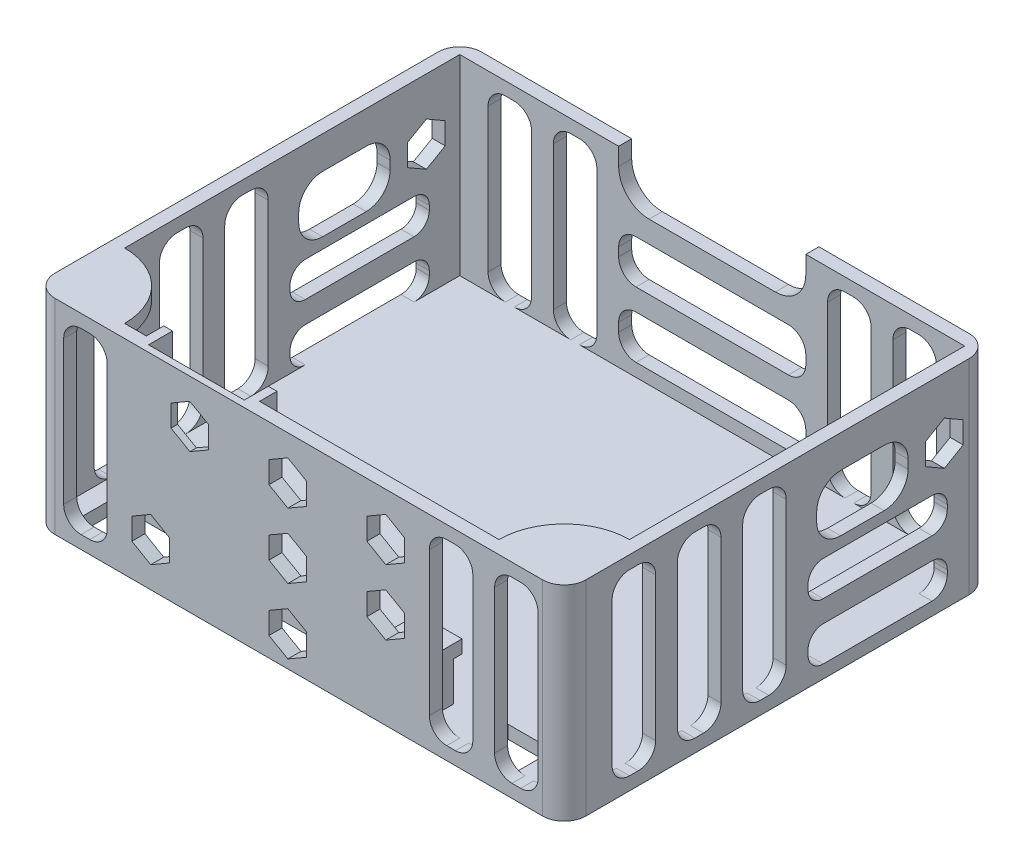
from build123d import *

# Parameters (mm, degrees)
SKETCH1_W                = 61
SKETCH1_H                = 49
BOSS_EXTRUDE1_DEPTH      = 23.5
SKETCH2_W                = 58
SKETCH2_H                = 46
CUT_EXTRUDE1_DEPTH       = 22
SKETCH3_W                = 16
SKETCH3_H                = 3
SKETCH3_W_2              = 5.2
SKETCH3_H_2              = 4.15
SKETCH3_W_3              = 12
SKETCH3_H_3              = 5
CUT_EXTRUDE2_DEPTH       = 1.5
SKETCH4_W                = 21.5
SKETCH4_H                = 1.5
CUT_EXTRUDE3_DEPTH       = 5.5
SKETCH5_W                = 10.5
SKETCH5_H                = 6.5
CUT_EXTRUDE6_DEPTH       = 61
SKETCH8_W                = 5
SKETCH8_H                = 3
BOSS_EXTRUDE2_DEPTH      = 6
SKETCH9_W                = 5
SKETCH9_H                = 1.5
BOSS_EXTRUDE3_DEPTH      = 1
SKETCH10_W               = 11
SKETCH10_H               = 11
CUT_EXTRUDE8_DEPTH       = 0.75
BOSS_EXTRUDE4_DEPTH      = 2
SKETCH12_W               = 7.5
SKETCH12_H               = 7.5
BOSS_EXTRUDE5_DEPTH      = 1.5
FILLET1_R                = 2.75
FILLET2_R                = 2.75
FILLET3_R                = 2.75
FILLET4_R                = 2.75
FILLET5_R                = 3.5
FILLET6_R                = 3.5
FILLET7_R                = 7.5
FILLET8_R                = 7.5
FILLET9_R                = 2.5
FILLET10_R               = 2.5
FILLET11_R               = 2.5
FILLET12_R               = 2.5
CUT_EXTRUDE10_DEPTH      = 61
FILLET13_R               = 2.75
FILLET14_R               = 2.75
FILLET15_R               = 2.75
FILLET16_R               = 2.75
CUT_EXTRUDE11_DEPTH      = 61
CUT_EXTRUDE12_DEPTH      = 1.5
CUT_EXTRUDE14_DEPTH      = 61
CUT_EXTRUDE15_DEPTH      = 1.5
CUT_EXTRUDE18_DEPTH      = 1.5
CUT_EXTRUDE18_DEPTH_BACK = 1.5
CUT_EXTRUDE19_DEPTH      = 1.5


with BuildPart() as part:
    # Sketch1 → Boss-Extrude1 (new body)
    with BuildSketch(Plane(origin=(0, 0, 0), x_dir=(1, 0, 0), z_dir=(0, 1, 0))):
        with Locations((-50.798701292, -19.282823978)):
            Rectangle(SKETCH1_W, SKETCH1_H)
    extrude(amount=BOSS_EXTRUDE1_DEPTH)

    # Sketch2 → Cut-Extrude1 (cut)
    with BuildSketch(Plane(origin=(0, 23.5, 0), x_dir=(1, 0, 0), z_dir=(0, 1, 0))):
        with Locations((-50.798701292, -19.282823978)):
            Rectangle(SKETCH2_W, SKETCH2_H)
    extrude(amount=-CUT_EXTRUDE1_DEPTH, mode=Mode.SUBTRACT)

    # Sketch3 → Cut-Extrude2 (cut)
    with BuildSketch(Plane(origin=(0, 1.5, 0), x_dir=(1, 0, 0), z_dir=(0, 1, 0))):
        with Locations((-50.538701292, -40.782823978)):
            Rectangle(SKETCH3_W, SKETCH3_H)
        with Locations((-29.798701292, -40.207823978)):
            Rectangle(SKETCH3_W_2, SKETCH3_H_2)
        with Locations((-71.538701292, -39.782823978)):
            Rectangle(SKETCH3_W_3, SKETCH3_H_3)
    extrude(amount=-CUT_EXTRUDE2_DEPTH, mode=Mode.SUBTRACT)

    # Sketch4 → Cut-Extrude3 (cut)
    with BuildSketch(Plane(origin=(0, 23.5, 0), x_dir=(1, 0, 0), z_dir=(0, 1, 0))):
        with Locations((-50.798701292, 4.467176022)):
            Rectangle(SKETCH4_W, SKETCH4_H)
    extrude(amount=-CUT_EXTRUDE3_DEPTH, mode=Mode.SUBTRACT)

    # Sketch5 → Cut-Extrude6 (cut)
    with BuildSketch(Plane.ZY.offset(81.298701292)):
        with Locations((9.532823978, 16.5)):
            Rectangle(SKETCH5_W, SKETCH5_H)
    extrude(amount=-CUT_EXTRUDE6_DEPTH, mode=Mode.SUBTRACT)

    # Sketch8 → Boss-Extrude2 (add)
    with BuildSketch(Plane(origin=(0, 1.5, 0), x_dir=(1, 0, 0), z_dir=(0, 1, 0))):
        with Locations((-40.038701292, -40.782823978)):
            Rectangle(SKETCH8_W, SKETCH8_H)
        with Locations((-61.038701292, -40.782823978)):
            Rectangle(SKETCH8_W, SKETCH8_H)
    extrude(amount=BOSS_EXTRUDE2_DEPTH)

    # Sketch9 → Boss-Extrude3 (add)
    with BuildSketch(Plane(origin=(0, 0, 39.282823978), x_dir=(-1, 0, 0), z_dir=(0, 0, -1))):
        with Locations((40.038701292, 6.75)):
            Rectangle(SKETCH9_W, SKETCH9_H)
        with Locations((61.038701292, 6.75)):
            Rectangle(SKETCH9_W, SKETCH9_H)
    extrude(amount=BOSS_EXTRUDE3_DEPTH)

    # Sketch10 → Cut-Extrude8 (cut)
    with BuildSketch(Plane(origin=(0, 0, 42.282823978), x_dir=(-1, 0, 0), z_dir=(0, 0, -1))):
        with Locations((63.298701292, 18)):
            Rectangle(SKETCH10_W, SKETCH10_H)
    extrude(amount=-CUT_EXTRUDE8_DEPTH, mode=Mode.SUBTRACT)

    # Sketch11 → Boss-Extrude4 (add)
    with BuildSketch(Plane(origin=(0, 0, 42.282823978), x_dir=(-1, 0, 0), z_dir=(0, 0, -1))):
        Polygon((57.798701292, 12.5), (57.798701292, 23.5), (56.798701292, 23.5), (56.798701292, 11.5), (69.798701292, 11.5), (69.798701292, 23.5), (68.798701292, 23.5), (68.798701292, 12.5), align=None)
    extrude(amount=BOSS_EXTRUDE4_DEPTH)

    # Sketch12 → Boss-Extrude5 (add)
    with BuildSketch(Plane(origin=(0, 23.5, 0), x_dir=(1, 0, 0), z_dir=(0, 1, 0))):
        with Locations((-25.548701292, -38.532823978)):
            Rectangle(SKETCH12_W, SKETCH12_H)
        with Locations((-76.048701292, -38.532823978)):
            Rectangle(SKETCH12_W, SKETCH12_H)
    extrude(amount=-BOSS_EXTRUDE5_DEPTH)

    # Fillet1
    fillet1_edges = [part.edges().sort_by_distance(p)[0] for p in [
        (-80.548701292, 13.25, 14.782823978),
    ]]
    fillet(fillet1_edges, radius=FILLET1_R)

    # Fillet2
    fillet2_edges = [part.edges().sort_by_distance(p)[0] for p in [
        (-80.548701292, 19.75, 14.782823978),
    ]]
    fillet(fillet2_edges, radius=FILLET2_R)

    # Fillet3
    fillet3_edges = [part.edges().sort_by_distance(p)[0] for p in [
        (-80.548701292, 19.75, 4.282823978),
    ]]
    fillet(fillet3_edges, radius=FILLET3_R)

    # Fillet4
    fillet4_edges = [part.edges().sort_by_distance(p)[0] for p in [
        (-80.548701292, 13.25, 4.282823978),
    ]]
    fillet(fillet4_edges, radius=FILLET4_R)

    # Fillet5
    fillet5_edges = [part.edges().sort_by_distance(p)[0] for p in [
        (-40.048701292, 18, -4.467176022),
    ]]
    fillet(fillet5_edges, radius=FILLET5_R)

    # Fillet6
    fillet6_edges = [part.edges().sort_by_distance(p)[0] for p in [
        (-61.548701292, 18, -4.467176022),
    ]]
    fillet(fillet6_edges, radius=FILLET6_R)

    # Fillet7
    fillet7_edges = [part.edges().sort_by_distance(p)[0] for p in [
        (-29.298701292, 22.75, 34.782823978),
    ]]
    fillet(fillet7_edges, radius=FILLET7_R - 0.0001)  # a hair under: the kernel refuses the full size

    # Fillet8
    fillet8_edges = [part.edges().sort_by_distance(p)[0] for p in [
        (-72.298701292, 22.75, 34.782823978),
    ]]
    fillet(fillet8_edges, radius=FILLET8_R - 0.0001)  # a hair under: the kernel refuses the full size

    # Fillet9
    fillet9_edges = [part.edges().sort_by_distance(p)[0] for p in [
        (-20.298701292, 11.75, -5.217176022),
    ]]
    fillet(fillet9_edges, radius=FILLET9_R)

    # Fillet10
    fillet10_edges = [part.edges().sort_by_distance(p)[0] for p in [
        (-81.298701292, 11.75, -5.217176022),
    ]]
    fillet(fillet10_edges, radius=FILLET10_R)

    # Fillet11
    fillet11_edges = [part.edges().sort_by_distance(p)[0] for p in [
        (-81.298701292, 11.75, 43.782823978),
    ]]
    fillet(fillet11_edges, radius=FILLET11_R)

    # Fillet12
    fillet12_edges = [part.edges().sort_by_distance(p)[0] for p in [
        (-20.298701292, 11.75, 43.782823978),
    ]]
    fillet(fillet12_edges, radius=FILLET12_R)

    # Sketch13 → Cut-Extrude10 (cut)
    with BuildSketch(Plane(origin=(-20.298701292, 0, 0), x_dir=(0, 0, -1), z_dir=(1, 0, 0))):
        with BuildLine():
            Line((-36.282823978, 22), (-35.282823978, 22))
            ThreePointArc((-35.282823978, 22), (-33.868610415, 21.414213562), (-33.282823978, 20))
            Line((-33.282823978, 20), (-33.282823978, 3.5))
            ThreePointArc((-33.282823978, 3.5), (-33.868610415, 2.085786438), (-35.282823978, 1.5))
            Line((-35.282823978, 1.5), (-36.282823978, 1.5))
            ThreePointArc((-36.282823978, 1.5), (-37.69703754, 2.085786438), (-38.282823978, 3.5))
            Line((-38.282823978, 3.5), (-38.282823978, 20))
            ThreePointArc((-38.282823978, 20), (-37.69703754, 21.414213562), (-36.282823978, 22))
        make_face()
        with BuildLine():
            Line((-28.782823978, 22), (-27.782823978, 22))
            ThreePointArc((-27.782823978, 22), (-26.368610415, 21.414213562), (-25.782823978, 20))
            Line((-25.782823978, 20), (-25.782823978, 3.5))
            ThreePointArc((-25.782823978, 3.5), (-26.368610415, 2.085786438), (-27.782823978, 1.5))
            Line((-27.782823978, 1.5), (-28.782823978, 1.5))
            ThreePointArc((-28.782823978, 1.5), (-30.19703754, 2.085786438), (-30.782823978, 3.5))
            Line((-30.782823978, 3.5), (-30.782823978, 20))
            ThreePointArc((-30.782823978, 20), (-30.19703754, 21.414213562), (-28.782823978, 22))
        make_face()
        with BuildLine():
            Line((-21.282823978, 22), (-20.282823978, 22))
            ThreePointArc((-20.282823978, 22), (-18.868610415, 21.414213562), (-18.282823978, 20))
            Line((-18.282823978, 20), (-18.282823978, 3.5))
            ThreePointArc((-18.282823978, 3.5), (-18.868610415, 2.085786438), (-20.282823978, 1.5))
            Line((-20.282823978, 1.5), (-21.282823978, 1.5))
            ThreePointArc((-21.282823978, 1.5), (-22.69703754, 2.085786438), (-23.282823978, 3.5))
            Line((-23.282823978, 3.5), (-23.282823978, 20))
            ThreePointArc((-23.282823978, 20), (-22.69703754, 21.414213562), (-21.282823978, 22))
        make_face()
    extrude(amount=-CUT_EXTRUDE10_DEPTH, mode=Mode.SUBTRACT)

    # Fillet13
    fillet13_edges = [part.edges().sort_by_distance(p)[0] for p in [
        (-21.048701292, 13.25, 14.782823978),
    ]]
    fillet(fillet13_edges, radius=FILLET13_R)

    # Fillet14
    fillet14_edges = [part.edges().sort_by_distance(p)[0] for p in [
        (-21.048701292, 19.75, 14.782823978),
    ]]
    fillet(fillet14_edges, radius=FILLET14_R)

    # Fillet15
    fillet15_edges = [part.edges().sort_by_distance(p)[0] for p in [
        (-21.048701292, 13.25, 4.282823978),
    ]]
    fillet(fillet15_edges, radius=FILLET15_R)

    # Fillet16
    fillet16_edges = [part.edges().sort_by_distance(p)[0] for p in [
        (-21.048701292, 19.75, 4.282823978),
    ]]
    fillet(fillet16_edges, radius=FILLET16_R)

    # Sketch16 → Cut-Extrude11 (cut)
    with BuildSketch(Plane(origin=(-20.298701292, 0, 0), x_dir=(0, 0, -1), z_dir=(1, 0, 0))):
        Polygon((-0.117760468, 19), (-2.282823978, 17.75), (-2.282823978, 15.25), (-0.117760468, 14), (2.047303041, 15.25), (2.047303041, 17.75), align=None)
    extrude(amount=-CUT_EXTRUDE11_DEPTH, mode=Mode.SUBTRACT)

    # Sketch19 → Cut-Extrude12 (cut)
    with BuildSketch(Plane(origin=(0, 0, -5.217176022), x_dir=(-1, 0, 0), z_dir=(0, 0, -1))):
        with BuildLine():
            Line((66.048701292, 22), (67.048701292, 22))
            ThreePointArc((67.048701292, 22), (68.462914854, 21.414213562), (69.048701292, 20))
            Line((69.048701292, 20), (69.048701292, 3.5))
            ThreePointArc((69.048701292, 3.5), (68.462914854, 2.085786438), (67.048701292, 1.5))
            Line((67.048701292, 1.5), (66.048701292, 1.5))
            ThreePointArc((66.048701292, 1.5), (64.634487729, 2.085786438), (64.048701292, 3.5))
            Line((64.048701292, 3.5), (64.048701292, 20))
            ThreePointArc((64.048701292, 20), (64.634487729, 21.414213562), (66.048701292, 22))
        make_face()
        with BuildLine():
            Line((73.548701292, 22), (74.548701292, 22))
            ThreePointArc((74.548701292, 22), (75.962914854, 21.414213562), (76.548701292, 20))
            Line((76.548701292, 20), (76.548701292, 3.5))
            ThreePointArc((76.548701292, 3.5), (75.962914854, 2.085786438), (74.548701292, 1.5))
            Line((74.548701292, 1.5), (73.548701292, 1.5))
            ThreePointArc((73.548701292, 1.5), (72.134487729, 2.085786438), (71.548701292, 3.5))
            Line((71.548701292, 3.5), (71.548701292, 20))
            ThreePointArc((71.548701292, 20), (72.134487729, 21.414213562), (73.548701292, 22))
        make_face()
        with BuildLine():
            Line((27.048701292, 22), (28.048701292, 22))
            ThreePointArc((28.048701292, 22), (29.462914854, 21.414213562), (30.048701292, 20))
            Line((30.048701292, 20), (30.048701292, 3.5))
            ThreePointArc((30.048701292, 3.5), (29.462914854, 2.085786438), (28.048701292, 1.5))
            Line((28.048701292, 1.5), (27.048701292, 1.5))
            ThreePointArc((27.048701292, 1.5), (25.634487729, 2.085786438), (25.048701292, 3.5))
            Line((25.048701292, 3.5), (25.048701292, 20))
            ThreePointArc((25.048701292, 20), (25.634487729, 21.414213562), (27.048701292, 22))
        make_face()
        with BuildLine():
            Line((34.548701292, 22), (35.548701292, 22))
            ThreePointArc((35.548701292, 22), (36.962914854, 21.414213562), (37.548701292, 20))
            Line((37.548701292, 20), (37.548701292, 3.5))
            ThreePointArc((37.548701292, 3.5), (36.962914854, 2.085786438), (35.548701292, 1.5))
            Line((35.548701292, 1.5), (34.548701292, 1.5))
            ThreePointArc((34.548701292, 1.5), (33.134487729, 2.085786438), (32.548701292, 3.5))
            Line((32.548701292, 3.5), (32.548701292, 20))
            ThreePointArc((32.548701292, 20), (33.134487729, 21.414213562), (34.548701292, 22))
        make_face()
        with BuildLine():
            Line((42.048701292, 15.5), (59.548701292, 15.5))
            ThreePointArc((59.548701292, 15.5), (60.962914854, 14.914213562), (61.548701292, 13.5))
            Line((61.548701292, 13.5), (61.548701292, 12.5))
            ThreePointArc((61.548701292, 12.5), (60.962914854, 11.085786438), (59.548701292, 10.5))
            Line((59.548701292, 10.5), (42.048701292, 10.5))
            ThreePointArc((42.048701292, 10.5), (40.634487729, 11.085786438), (40.048701292, 12.5))
            Line((40.048701292, 12.5), (40.048701292, 13.5))
            ThreePointArc((40.048701292, 13.5), (40.634487729, 14.914213562), (42.048701292, 15.5))
        make_face()
        with BuildLine():
            Line((42.048701292, 8), (59.548701292, 8))
            ThreePointArc((59.548701292, 8), (60.962914854, 7.414213562), (61.548701292, 6))
            Line((61.548701292, 6), (61.548701292, 5))
            ThreePointArc((61.548701292, 5), (60.962914854, 3.585786438), (59.548701292, 3))
            Line((59.548701292, 3), (42.048701292, 3))
            ThreePointArc((42.048701292, 3), (40.634487729, 3.585786438), (40.048701292, 5))
            Line((40.048701292, 5), (40.048701292, 6))
            ThreePointArc((40.048701292, 6), (40.634487729, 7.414213562), (42.048701292, 8))
        make_face()
    extrude(amount=-CUT_EXTRUDE12_DEPTH, mode=Mode.SUBTRACT)

    # Sketch20 → Cut-Extrude14 (cut)
    with BuildSketch(Plane(origin=(-20.298701292, 0, 0), x_dir=(0, 0, -1), z_dir=(1, 0, 0))):
        with BuildLine():
            Line((-1.532823978, 1.5), (-14.032823978, 1.5))
            ThreePointArc((-14.032823978, 1.5), (-15.270260845, 2.012563133), (-15.782823978, 3.25))
            Line((-15.782823978, 3.25), (-15.782823978, 3.75))
            ThreePointArc((-15.782823978, 3.75), (-15.270260845, 4.987436867), (-14.032823978, 5.5))
            Line((-14.032823978, 5.5), (-1.532823978, 5.5))
            ThreePointArc((-1.532823978, 5.5), (-0.295387111, 4.987436867), (0.217176022, 3.75))
            Line((0.217176022, 3.75), (0.217176022, 3.25))
            ThreePointArc((0.217176022, 3.25), (-0.295387111, 2.012563133), (-1.532823978, 1.5))
        make_face()
        with BuildLine():
            Line((-1.532823978, 8), (-14.032823978, 8))
            ThreePointArc((-14.032823978, 8), (-15.270260845, 8.512563133), (-15.782823978, 9.75))
            Line((-15.782823978, 9.75), (-15.782823978, 10.25))
            ThreePointArc((-15.782823978, 10.25), (-15.270260845, 11.487436867), (-14.032823978, 12))
            Line((-14.032823978, 12), (-1.532823978, 12))
            ThreePointArc((-1.532823978, 12), (-0.295387111, 11.487436867), (0.217176022, 10.25))
            Line((0.217176022, 10.25), (0.217176022, 9.75))
            ThreePointArc((0.217176022, 9.75), (-0.295387111, 8.512563133), (-1.532823978, 8))
        make_face()
    extrude(amount=-CUT_EXTRUDE14_DEPTH, mode=Mode.SUBTRACT)

    # Sketch22 → Cut-Extrude15 (cut)
    with BuildSketch(Plane(origin=(0, 0, 42.282823978), x_dir=(-1, 0, 0), z_dir=(0, 0, -1))):
        with BuildLine():
            Line((75.798701292, 22), (74.798701292, 22))
            ThreePointArc((74.798701292, 22), (73.384487729, 21.414213562), (72.798701292, 20))
            Line((72.798701292, 20), (72.798701292, 3.5))
            ThreePointArc((72.798701292, 3.5), (73.384487729, 2.085786438), (74.798701292, 1.5))
            Line((74.798701292, 1.5), (75.798701292, 1.5))
            ThreePointArc((75.798701292, 1.5), (77.212914854, 2.085786438), (77.798701292, 3.5))
            Line((77.798701292, 3.5), (77.798701292, 20))
            ThreePointArc((77.798701292, 20), (77.212914854, 21.414213562), (75.798701292, 22))
        make_face()
        with BuildLine():
            Line((26.298701292, 22), (25.298701292, 22))
            ThreePointArc((25.298701292, 22), (23.884487729, 21.414213562), (23.298701292, 20))
            Line((23.298701292, 20), (23.298701292, 3.5))
            ThreePointArc((23.298701292, 3.5), (23.884487729, 2.085786438), (25.298701292, 1.5))
            Line((25.298701292, 1.5), (26.298701292, 1.5))
            ThreePointArc((26.298701292, 1.5), (27.712914854, 2.085786438), (28.298701292, 3.5))
            Line((28.298701292, 3.5), (28.298701292, 20))
            ThreePointArc((28.298701292, 20), (27.712914854, 21.414213562), (26.298701292, 22))
        make_face()
        with BuildLine():
            Line((33.798701292, 22), (32.798701292, 22))
            ThreePointArc((32.798701292, 22), (31.384487729, 21.414213562), (30.798701292, 20))
            Line((30.798701292, 20), (30.798701292, 3.5))
            ThreePointArc((30.798701292, 3.5), (31.384487729, 2.085786438), (32.798701292, 1.5))
            Line((32.798701292, 1.5), (33.798701292, 1.5))
            ThreePointArc((33.798701292, 1.5), (35.212914854, 2.085786438), (35.798701292, 3.5))
            Line((35.798701292, 3.5), (35.798701292, 20))
            ThreePointArc((35.798701292, 20), (35.212914854, 21.414213562), (33.798701292, 22))
        make_face()
    extrude(amount=-CUT_EXTRUDE15_DEPTH, mode=Mode.SUBTRACT)

    # Sketch23 → Cut-Extrude18 (cut, two sides: drawn at the far end of the back side and taken through both)
    with BuildSketch(Plane(origin=(0, 0, 43.032823978), x_dir=(-1, 0, 0), z_dir=(0, 0, -1)).offset(-CUT_EXTRUDE18_DEPTH_BACK)):
        Polygon((40.798701292, 16), (42.963764801, 17.25), (42.963764801, 19.75), (40.798701292, 21), (38.633637782, 19.75), (38.633637782, 17.25), align=None)
        Polygon((52.048701292, 16), (54.213764801, 17.25), (54.213764801, 19.75), (52.048701292, 21), (49.883637782, 19.75), (49.883637782, 17.25), align=None)
        Polygon((63.298701292, 16), (65.463764801, 17.25), (65.463764801, 19.75), (63.298701292, 21), (61.133637782, 19.75), (61.133637782, 17.25), align=None)
        Polygon((52.048701292, 8.5), (54.213764801, 9.75), (54.213764801, 12.25), (52.048701292, 13.5), (49.883637782, 12.25), (49.883637782, 9.75), align=None)
        Polygon((52.048701292, 1), (54.213764801, 2.25), (54.213764801, 4.75), (52.048701292, 6), (49.883637782, 4.75), (49.883637782, 2.25), align=None)
        Polygon((40.798701292, 8.5), (42.963764801, 9.75), (42.963764801, 12.25), (40.798701292, 13.5), (38.633637782, 12.25), (38.633637782, 9.75), align=None)
    extrude(amount=CUT_EXTRUDE18_DEPTH + CUT_EXTRUDE18_DEPTH_BACK, mode=Mode.SUBTRACT)

    # Sketch24 → Cut-Extrude19 (cut)
    with BuildSketch(Plane(origin=(0, 0, 42.282823978), x_dir=(-1, 0, 0), z_dir=(0, 0, -1))):
        Polygon((67.798701292, 7.5), (65.633637782, 6.25), (65.633637782, 3.75), (67.798701292, 2.5), (69.963764801, 3.75), (69.963764801, 6.25), align=None)
    extrude(amount=-CUT_EXTRUDE19_DEPTH, mode=Mode.SUBTRACT)


solid = part.part
